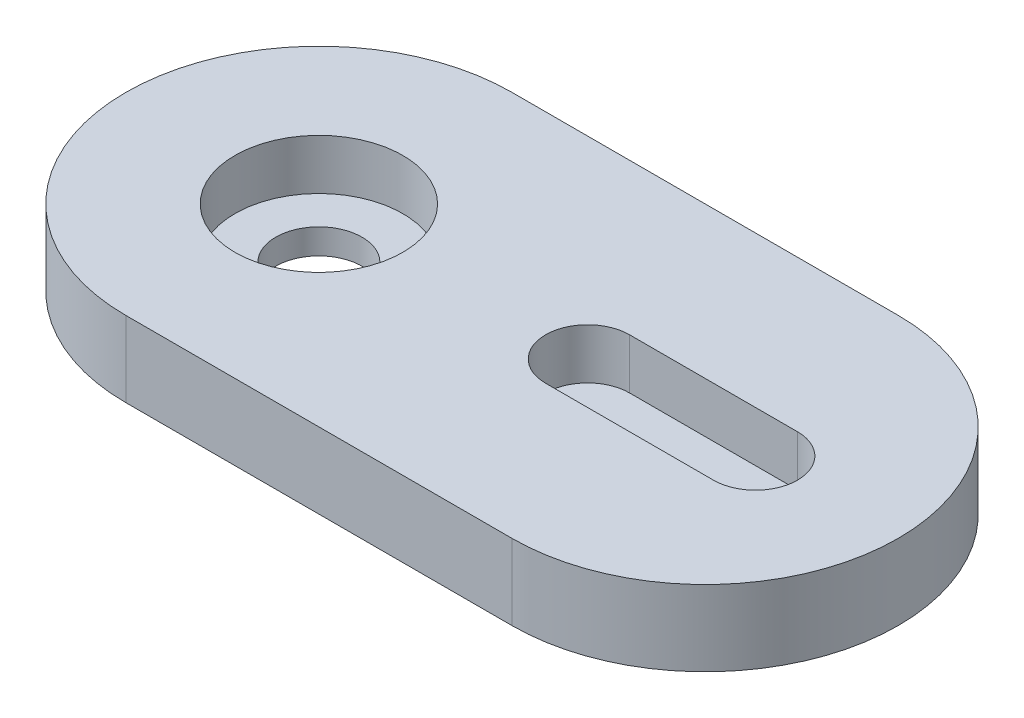
from build123d import *

# Parameters (mm, degrees)
BOSS_EXTRUDE1_DEPTH = 2.8575
SKETCH2_R           = 1.63195
CUT_EXTRUDE1_DEPTH  = 3.048
SKETCH3_R           = 3.175
CUT_EXTRUDE2_DEPTH  = 1.905


with BuildPart() as part:
    # Sketch1 → Boss-Extrude1 (new body)
    with BuildSketch(Plane(origin=(0, 0, 0), x_dir=(1, 0, 0), z_dir=(0, 1, 0))):
        with BuildLine():
            Line((14.605, 7.3025), (0, 7.3025))
            ThreePointArc((0, 7.3025), (-7.3025, 0), (0, -7.3025))
            Line((0, -7.3025), (14.605, -7.3025))
            ThreePointArc((14.605, -7.3025), (21.9075, 0), (14.605, 7.3025))
        make_face()
    extrude(amount=BOSS_EXTRUDE1_DEPTH)

    # Sketch2 → Cut-Extrude1 (cut)
    with BuildSketch(Plane(origin=(0, 2.8575, 0), x_dir=(1, 0, 0), z_dir=(0, 1, 0))):
        Circle(SKETCH2_R)
    extrude(amount=-CUT_EXTRUDE1_DEPTH, mode=Mode.SUBTRACT)

    # Sketch3 → Cut-Extrude2 (cut)
    with BuildSketch(Plane(origin=(0, 2.8575, 0), x_dir=(1, 0, 0), z_dir=(0, 1, 0))):
        Circle(SKETCH3_R)
        with BuildLine():
            Line((10.16, 1.5875), (16.51, 1.5875))
            ThreePointArc((16.51, 1.5875), (18.0975, 0), (16.51, -1.5875))
            Line((16.51, -1.5875), (10.16, -1.5875))
            ThreePointArc((10.16, -1.5875), (8.5725, 0), (10.16, 1.5875))
        make_face()
    extrude(amount=-CUT_EXTRUDE2_DEPTH, mode=Mode.SUBTRACT)


solid = part.part
